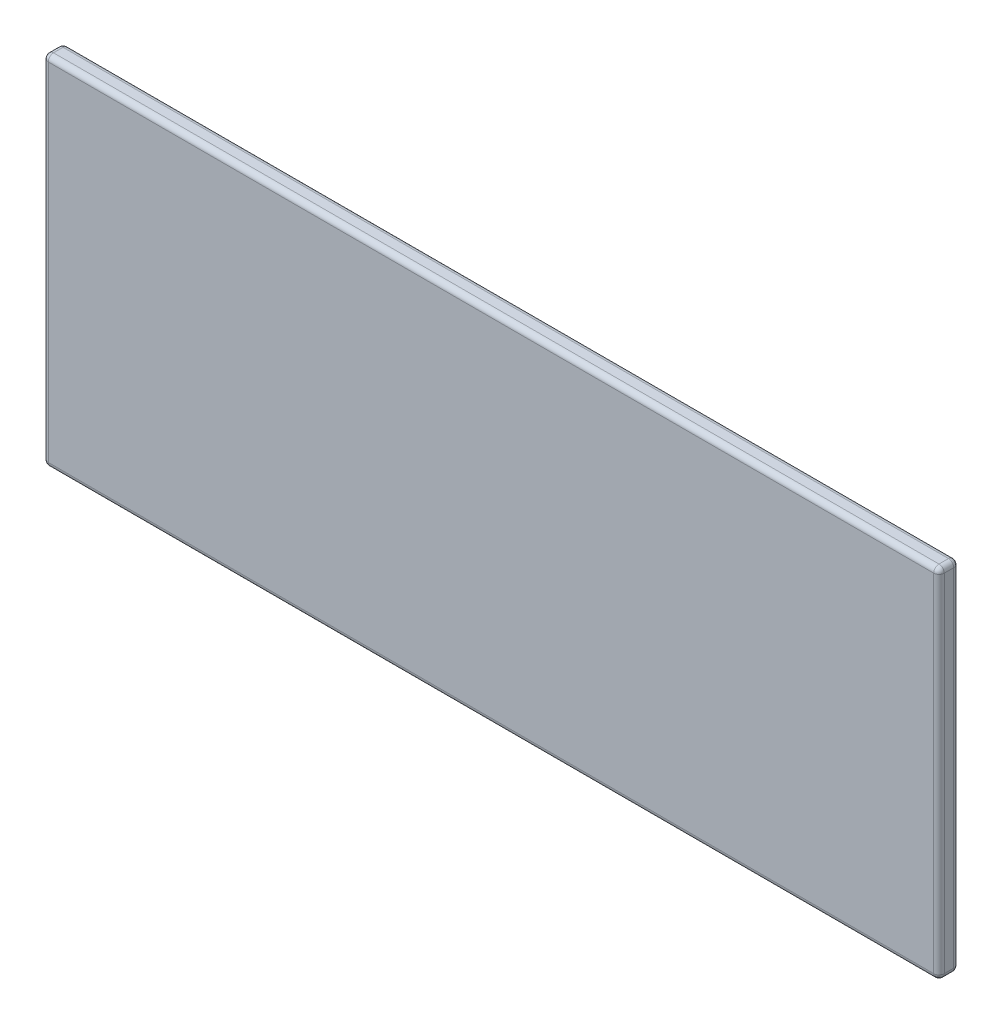
from build123d import *

# Parameters (mm, degrees)
SKETCH_1_W      = 170
SKETCH_1_H      = 67.8
EXTRUDE_1_DEPTH = 3.8
FILLET_1_R      = 1


with BuildPart() as part:
    # 草图1 → 凸台-拉伸1 (new body)
    with BuildSketch(Plane.XY):
        Rectangle(SKETCH_1_W, SKETCH_1_H)
    extrude(amount=EXTRUDE_1_DEPTH)

    # 圆角1
    fillet_1_edges = [part.edges().sort_by_distance(p)[0] for p in [
        (0, -33.9, 3.8),
        (0, -33.9, 0),
        (0, 33.9, 3.8),
        (0, 33.9, 0),
        (-85, 33.9, 1.9),
        (-85, 0, 3.8),
        (-85, -33.9, 1.9),
        (-85, 0, 0),
        (85, -33.9, 1.9),
        (85, 0, 3.8),
        (85, 33.9, 1.9),
        (85, 0, 0),
    ]]
    fillet(fillet_1_edges, radius=FILLET_1_R)


solid = part.part
